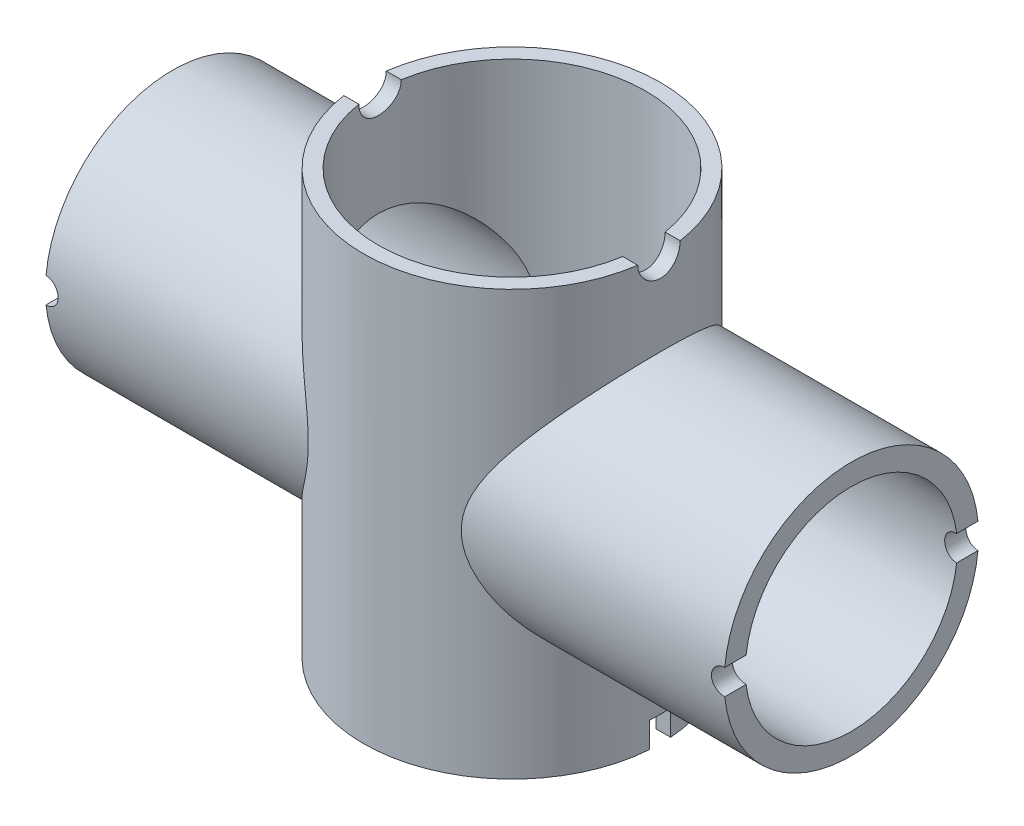
from build123d import *

# Parameters (mm, degrees)
SKETCH1_R                = 44.45
BOSS_EXTRUDE1_DEPTH      = 127
BOSS_EXTRUDE2_DEPTH      = 101.6
BOSS_EXTRUDE2_DEPTH_BACK = 101.6
SKETCH2_R                = 38.1
SKETCH3_R                = 40.005
CUT_EXTRUDE1_DEPTH       = 169.604159363
SKETCH4_R                = 31.75
CUT_EXTRUDE2_DEPTH       = 244.710981646
CUT_EXTRUDE4_START       = -3.175
CUT_EXTRUDE4_OUTLINE_W   = 8
CUT_EXTRUDE4_OUTLINE_H   = 7.62
CUT_EXTRUDE4_DEPTH       = 6.35
CUT_EXTRUDE5_DEPTH       = 169.604159363
CUT_EXTRUDE5_DEPTH_BACK  = 169.604159363
CUT_EXTRUDE6_DEPTH       = 169.604159363


# Read off the part's stored shape, not the designer's step: Cut-Extrude4
with BuildPart() as part:
    # Sketch1 → Boss-Extrude1 (new body)
    with BuildSketch(Plane(origin=(0, 0, 0), x_dir=(1, 0, 0), z_dir=(0, 1, 0))):
        with Locations(Location((0, 0, 0), (0, 0, 270))):
            Circle(SKETCH1_R)
    extrude(amount=BOSS_EXTRUDE1_DEPTH)

    # Sketch2 → Boss-Extrude2 (add, two sides: drawn at the far end of the back side and taken through both)
    with BuildSketch(Plane(origin=(0, 0, 0), x_dir=(0, 0, -1), z_dir=(1, 0, 0)).offset(-BOSS_EXTRUDE2_DEPTH_BACK)):
        with Locations((0, 63.5)):
            Circle(SKETCH2_R)
    extrude(amount=BOSS_EXTRUDE2_DEPTH + BOSS_EXTRUDE2_DEPTH_BACK)

    # Sketch3 → Cut-Extrude1 (cut, through all)
    with BuildSketch(Plane(origin=(0, 127, 0), x_dir=(1, 0, 0), z_dir=(0, 1, 0))):
        with Locations(Location((0, 0, 0), (0, 0, 270))):
            Circle(SKETCH3_R)
    extrude(amount=-CUT_EXTRUDE1_DEPTH, mode=Mode.SUBTRACT)

    # Sketch4 → Cut-Extrude2 (cut, through all)
    with BuildSketch(Plane(origin=(101.6, 0, 0), x_dir=(0, 0, -1), z_dir=(1, 0, 0))):
        with Locations((0, 63.5)):
            Circle(SKETCH4_R)
    extrude(amount=-CUT_EXTRUDE2_DEPTH, mode=Mode.SUBTRACT)

    # Cut-Extrude4 outline → Cut-Extrude4 (cut)
    with BuildSketch(Plane.XY.offset(CUT_EXTRUDE4_START)):
        with Locations((42, 3.81)):
            Rectangle(CUT_EXTRUDE4_OUTLINE_W, CUT_EXTRUDE4_OUTLINE_H)
    extrude(amount=CUT_EXTRUDE4_DEPTH, mode=Mode.SUBTRACT)

    # Sketch6 → Cut-Extrude5 (cut, two sides: drawn at the far end of the back side and taken through both)
    with BuildSketch(Plane(origin=(0, 0, 0), x_dir=(0, 0, -1), z_dir=(1, 0, 0)).offset(-CUT_EXTRUDE5_DEPTH_BACK)):
        with BuildLine():
            Line((6.35, 127), (-6.35, 127))
            ThreePointArc((-6.35, 127), (0, 120.65), (6.35, 127))
        make_face()
    extrude(amount=CUT_EXTRUDE5_DEPTH + CUT_EXTRUDE5_DEPTH_BACK, mode=Mode.SUBTRACT)

    # Sketch7 → Cut-Extrude6 (cut, symmetric)
    with BuildSketch(Plane.XY):
        with BuildLine():
            Line((-101.6, 67.31), (-101.6, 59.69))
            ThreePointArc((-101.6, 59.69), (-97.79, 63.5), (-101.6, 67.31))
        make_face()
    cut_extrude6 = extrude(amount=CUT_EXTRUDE6_DEPTH, both=True, mode=Mode.SUBTRACT)

    # Mirror1: Cut-Extrude6 across plane
    add(cut_extrude6.mirror(Plane(origin=(0, 0, 0), x_dir=(0, 0, 1), z_dir=(1, 0, 0))), mode=Mode.SUBTRACT)


solid = part.part
